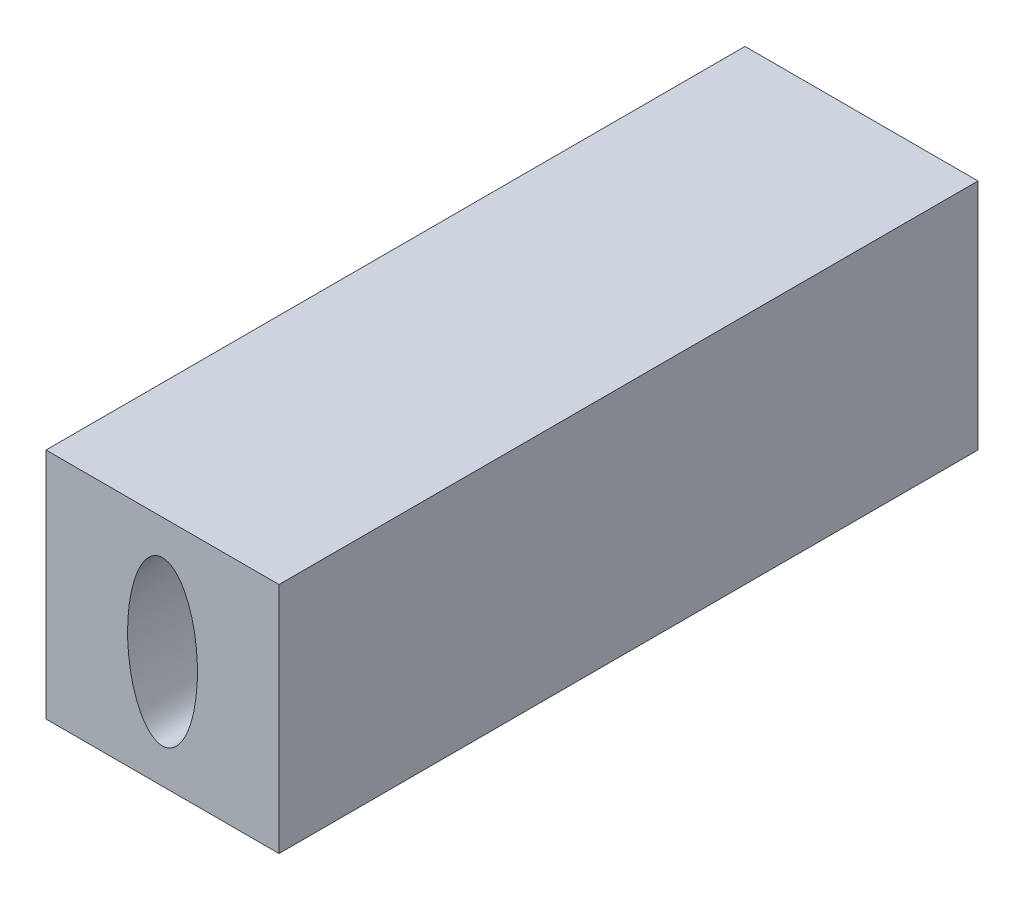
from build123d import *

# Parameters (mm, degrees)
SKETCH_1_W        = 1000
SKETCH_1_H        = 1000
EXTRUDE_204_DEPTH = 3000
OTHER_START       = -3000
OTHER_3_DEPTH     = 3000


# Read off the part's stored shape, not the designer's step: Полость3
with BuildPart() as part:
    # Эскиз1 → Extrude 204 (new body)
    with BuildSketch(Plane.XY):
        with Locations((500, 500)):
            Rectangle(SKETCH_1_W, SKETCH_1_H)
    extrude(amount=-EXTRUDE_204_DEPTH)

    # Полость3 outline → Полость3 (cut)
    with BuildSketch(Plane.XY.offset(OTHER_START)):
        with BuildLine():
            add(Edge.make_bspline(
                [(500, 850), (240.192378865, 850), (370.096189432, 325), (500, -200), (629.903810568, 325), (759.807621135, 850), (500, 850)],
                knots=[0, 0, 0, 2.094395102, 2.094395102, 4.188790205, 4.188790205, 6.283185307, 6.283185307, 6.283185307], degree=2, weights=[1, 0.5, 1, 0.5, 1, 0.5, 1]))
        make_face()
    extrude(amount=OTHER_3_DEPTH, mode=Mode.SUBTRACT)


solid = part.part
